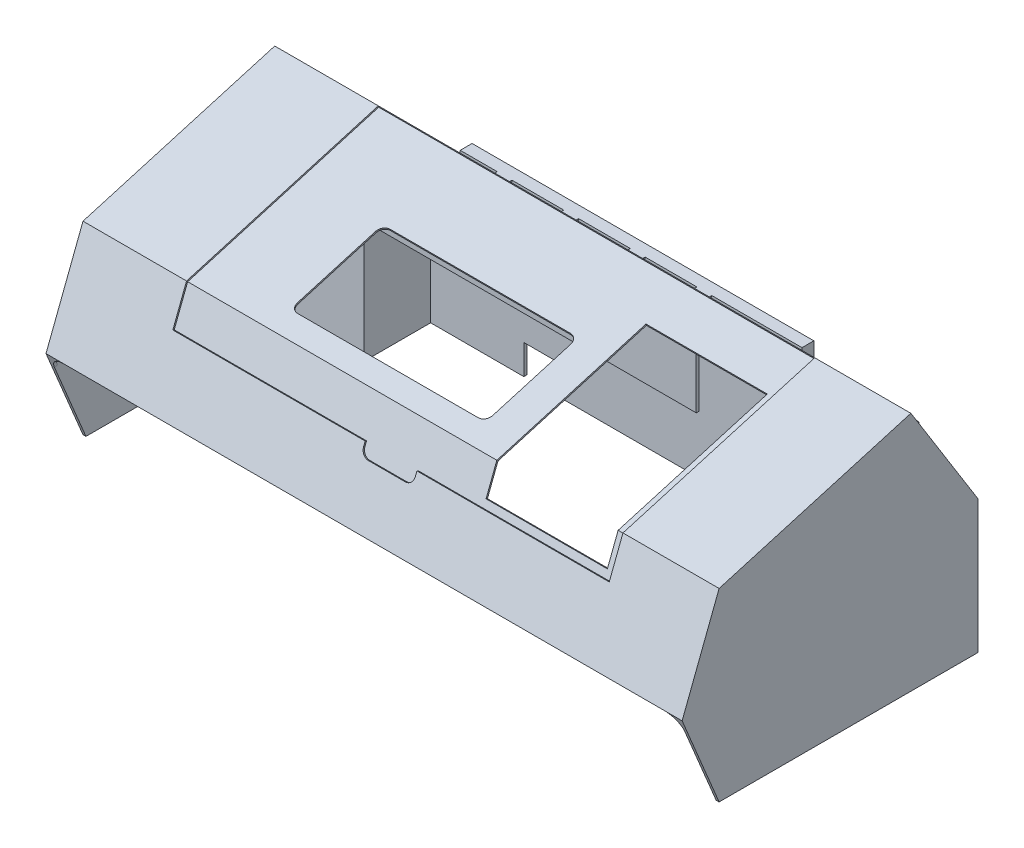
from build123d import *

# Parameters (mm, degrees)
SALIENTE_EXTRUIR1_DEPTH  = 330
CORTAR_EXTRUIR1_DEPTH    = 330
SALIENTE_EXTRUIR2_DEPTH  = 50
SALIENTE_EXTRUIR3_DEPTH  = 50
CORTAR_EXTRUIR2_DEPTH    = 48
CORTAR_EXTRUIR3_DEPTH    = 48
SALIENTE_EXTRUIR4_DEPTH  = 2
SALIENTE_EXTRUIR5_DEPTH  = 2
CORTAR_EXTRUIR4_DEPTH    = 2
CROQUIS12_W              = 295
CROQUIS12_H              = 135
CORTAR_EXTRUIR5_DEPTH    = 1
CROQUIS13_W              = 295
CROQUIS13_H              = 25.795813827
CORTAR_EXTRUIR7_DEPTH    = 1
CORTAR_EXTRUIR8_DEPTH    = 1
CROQUIS15_W              = 82
CROQUIS15_H              = 105
CORTAR_EXTRUIR9_DEPTH    = 1
CROQUIS16_W              = 82
CROQUIS16_H              = 20.300146856
CORTAR_EXTRUIR10_DEPTH   = 1
CORTAR_EXTRUIR11_REACH   = 465.661
CROQUIS17_W              = 25
CROQUIS17_H              = 20
CORTAR_EXTRUIR12_DEPTH   = 1
CROQUIS19_W              = 14
CROQUIS19_H              = 14
CORTAR_EXTRUIR13_DEPTH   = 1
CORTAR_EXTRUIR14_DEPTH   = 5
SALIENTE_EXTRUIR6_DEPTH  = 8
CROQUIS22_W              = 10
CROQUIS22_H              = 6
SALIENTE_EXTRUIR7_DEPTH  = 1
RESPIRADERO1_START       = 335
RESPIRADERO1_DEPTH       = 19.5
RESPIRADERO1_START_2     = 355.5
RESPIRADERO1_2_DEPTH     = 9.5
RESPIRADERO1_START_3     = 354.5
RESPIRADERO1_3_OUTLINE_W = 60
RESPIRADERO1_3_OUTLINE_H = 1
RESPIRADERO1_3_DEPTH     = 1
CROQUIS26_W              = 2
CROQUIS26_H              = 70
SALIENTE_EXTRUIR8_DEPTH  = 220
CROQUIS27_R              = 0.25
EJE_TAPA1_DEPTH          = 0.5
EJE_START                = -0.5
CROQUIS28_R              = 0.25
EJE_TAPA2_DEPTH          = 0.5


# Read off the part's stored shape, not the designer's step: Respiradero1
with BuildPart() as part:
    # Croquis1 → Saliente-Extruir1 (new body)
    with BuildSketch(Plane(origin=(0, 0, 0), x_dir=(0, 0, -1), z_dir=(1, 0, 0))):
        Polygon((0, 0), (-185, 0), (-210, 60), (-185, 125), (-55.380286871, 162.732346446), (0, 105), align=None)
    extrude(amount=SALIENTE_EXTRUIR1_DEPTH)

    # Croquis4 → Cortar-Extruir1 (cut)
    with BuildSketch(Plane(origin=(330, 0, 0), x_dir=(0, 0, -1), z_dir=(1, 0, 0))):
        Polygon((-182.833333333, 0), (-2, 0), (-2, 104.195827439), (-55.984752574, 160.473369765), (-183.489176933, 123.356784663), (-207.845728938, 60.029749451), align=None)
    extrude(amount=-CORTAR_EXTRUIR1_DEPTH, mode=Mode.SUBTRACT)

    # Croquis2 → Saliente-Extruir2 (add)
    with BuildSketch(Plane(origin=(330, 0, 0), x_dir=(0, 0, -1), z_dir=(1, 0, 0))):
        Polygon((-185, 0), (-210, 60), (-185, 125), (-55.380286871, 162.732346446), (-10, 90), (-10, 0), align=None)
    extrude(amount=SALIENTE_EXTRUIR2_DEPTH)

    # Croquis3 → Saliente-Extruir3 (add)
    with BuildSketch(Plane.ZY):
        Polygon((210, 60), (185, 0), (45, 0), (45, 135), (55.380286871, 162.732346446), (185, 125), align=None)
    extrude(amount=SALIENTE_EXTRUIR3_DEPTH)

    # Croquis6 → Cortar-Extruir2 (cut)
    with BuildSketch(Plane.ZY.offset(-330)):
        Polygon((56.589218277, 158.214393084), (58.202583542, 159.827758349), (183.489176933, 123.356784663), (207.845728938, 60.029749451), (182.833333333, 0), (12, 0), (12, 2), (12, 89.427236363), (51.810498539, 153.232716046), align=None)
    extrude(amount=-CORTAR_EXTRUIR2_DEPTH, mode=Mode.SUBTRACT)

    # Croquis8 → Cortar-Extruir3 (cut)
    with BuildSketch(Plane(origin=(0, 0, 0), x_dir=(0, 0, -1), z_dir=(1, 0, 0))):
        Polygon((-47, 2), (-47, 0), (-182.833333333, 0), (-207.845728938, 60.029749451), (-183.489176933, 123.356784663), (-58.203498077, 159.827492128), (-58.174989599, 159.835790957), (-58.151201716, 159.842715618), (-57.428061235, 159.088862593), (-55.335527594, 156.907456827), (-47, 134.637962552), align=None)
    extrude(amount=-CORTAR_EXTRUIR3_DEPTH, mode=Mode.SUBTRACT)

    # Croquis9 → Saliente-Extruir4 (add)
    with BuildSketch(Plane.ZY.offset(-330)):
        Polygon((12, 0), (0, 0), (0, 105), (55.380286871, 162.732346446), (58.202583542, 159.827758349), (51.810498539, 153.232716046), (12, 89.427236363), align=None)
    extrude(amount=SALIENTE_EXTRUIR4_DEPTH)

    # Croquis10 → Saliente-Extruir5 (add)
    with BuildSketch(Plane(origin=(0, 0, 0), x_dir=(0, 0, -1), z_dir=(1, 0, 0))):
        Polygon((-47, 0), (-47, 134.637962552), (-55.335527594, 156.907456827), (-58.151201716, 159.842715618), (-55.380286871, 162.732346446), (0, 105), (0, 0), align=None)
    extrude(amount=SALIENTE_EXTRUIR5_DEPTH)

    # Croquis11 → Cortar-Extruir4 (cut)
    with BuildSketch(Plane(origin=(0, -65.680473373, 157.633136095), x_dir=(1, 0, 0), z_dir=(0, -0.3846153846153845, 0.9230769230769232))):
        with BuildLine():
            Line((-48, 71.153846154), (-48, 126.153846154))
            ThreePointArc((-48, 126.153846154), (-45.071067812, 133.224913966), (-38, 136.153846154))
            Line((-38, 136.153846154), (368, 136.153846154))
            ThreePointArc((368, 136.153846154), (375.071067812, 133.224913966), (378, 126.153846154))
            Line((378, 126.153846154), (378, 71.153846154))
            Line((378, 71.153846154), (378, 69.153846154))
            Line((378, 69.153846154), (377.663887498, 69.153846154))
            Line((377.663887498, 69.153846154), (-48, 69.153846154))
            Line((-48, 69.153846154), (-48, 71.153846154))
        make_face()
    extrude(amount=-CORTAR_EXTRUIR4_DEPTH, mode=Mode.SUBTRACT)

    # Croquis12 → Cortar-Extruir5 (cut)
    with BuildSketch(Plane(origin=(0, 164.881596682, 47.997093793), x_dir=(1, 0, 0), z_dir=(0, 0.9601460231796526, 0.27949886255993606))):
        with Locations((167.5, -75.189656468)):
            Rectangle(CROQUIS12_W, CROQUIS12_H)
    extrude(amount=-CORTAR_EXTRUIR5_DEPTH, mode=Mode.SUBTRACT)

    # Croquis13 → Cortar-Extruir7 (cut)
    with BuildSketch(Plane(origin=(0, 78.092783505, 203.041237113), x_dir=(1, 0, 0), z_dir=(0, 0.3589790793088692, 0.9333456062030595))):
        with Locations((167.5, 37.359164189)):
            Rectangle(CROQUIS13_W, CROQUIS13_H)
    extrude(amount=-CORTAR_EXTRUIR7_DEPTH, mode=Mode.SUBTRACT)

    # Croquis14 → Cortar-Extruir8 (cut)
    with BuildSketch(Plane(origin=(0, 78.092783505, 203.041237113), x_dir=(1, 0, 0), z_dir=(0, 0.3589790793088692, 0.9333456062030595))):
        with BuildLine():
            Line((150, 24.461257276), (150, 21.461257276))
            ThreePointArc((150, 21.461257276), (151.464466094, 17.92572337), (155, 16.461257276))
            Line((155, 16.461257276), (180, 16.461257276))
            ThreePointArc((180, 16.461257276), (183.535533906, 17.92572337), (185, 21.461257276))
            Line((185, 21.461257276), (185, 24.461257276))
            Line((185, 24.461257276), (150, 24.461257276))
        make_face()
    extrude(amount=-CORTAR_EXTRUIR8_DEPTH, mode=Mode.SUBTRACT)

    # Croquis15 → Cortar-Extruir9 (cut)
    with BuildSketch(Plane(origin=(0, 163.921450659, 47.717594931), x_dir=(1, 0, 0), z_dir=(0, 0.9601460231796526, 0.2794988625599361))):
        with BuildLine():
            Line((80, -62.193989497), (202, -62.193989497))
            ThreePointArc((202, -62.193989497), (205.535533906, -63.658455592), (207, -67.193989497))
            Line((207, -67.193989497), (207, -122.193989497))
            ThreePointArc((207, -122.193989497), (205.535533906, -125.729523403), (202, -127.193989497))
            Line((202, -127.193989497), (80, -127.193989497))
            ThreePointArc((80, -127.193989497), (76.464466094, -125.729523403), (75, -122.193989497))
            Line((75, -122.193989497), (75, -67.193989497))
            ThreePointArc((75, -67.193989497), (76.464466094, -63.658455592), (80, -62.193989497))
        make_face()
        with Locations((270, -89.693989497)):
            Rectangle(CROQUIS15_W, CROQUIS15_H)
    extrude(amount=-CORTAR_EXTRUIR9_DEPTH, mode=Mode.SUBTRACT)

    # Croquis16 → Cortar-Extruir10 (cut)
    with BuildSketch(Plane(origin=(0, 77.733804426, 202.107891507), x_dir=(1, 0, 0), z_dir=(0, 0.35897907930886963, 0.9333456062030593))):
        with Locations((270, 39.611330704)):
            Rectangle(CROQUIS16_W, CROQUIS16_H)
    extrude(amount=-CORTAR_EXTRUIR10_DEPTH, mode=Mode.SUBTRACT)

    # Croquis17 → Cortar-Extruir11 (cut, up to next)
    with BuildSketch(Plane(origin=(0, 0, 0), x_dir=(-1, 0, 0), z_dir=(0, 0, -1)), mode=Mode.PRIVATE) as cortar_extruir11_sk1:
        with Locations((-77.5, 10)):
            Rectangle(CROQUIS17_W, CROQUIS17_H)
    cortar_extruir11_tool1 = extrude(cortar_extruir11_sk1.sketch, amount=-CORTAR_EXTRUIR11_REACH, mode=Mode.PRIVATE) & part.part
    add(cortar_extruir11_tool1.solids().sort_by_distance((77.5, 10, 0))[0], mode=Mode.SUBTRACT)

    # Croquis18 → Cortar-Extruir12 (cut)
    with BuildSketch(Plane(origin=(0, 0, 45), x_dir=(-1, 0, 0), z_dir=(0, 0, -1))):
        with BuildLine():
            Line((9, 123), (23, 123))
            ThreePointArc((23, 123), (24.414213562, 122.414213562), (25, 121))
            Line((25, 121), (25, 107))
            ThreePointArc((25, 107), (24.414213562, 105.585786438), (23, 105))
            Line((23, 105), (9, 105))
            ThreePointArc((9, 105), (7.585786438, 105.585786438), (7, 107))
            Line((7, 107), (7, 121))
            ThreePointArc((7, 121), (7.585786438, 122.414213562), (9, 123))
        make_face()
    extrude(amount=-CORTAR_EXTRUIR12_DEPTH, mode=Mode.SUBTRACT)

    # Croquis19 → Cortar-Extruir13 (cut)
    with BuildSketch(Plane(origin=(0, 0, 46), x_dir=(-1, 0, 0), z_dir=(0, 0, -1))):
        with Locations((16, 114)):
            Rectangle(CROQUIS19_W, CROQUIS19_H)
    extrude(amount=-CORTAR_EXTRUIR13_DEPTH, mode=Mode.SUBTRACT)

    # Croquis20 → Cortar-Extruir14 (cut)
    with BuildSketch(Plane(origin=(0, 50.317577853, -52.454618801), x_dir=(-1, 0, 0), z_dir=(0, 0.692253585884336, -0.7216543305698916))):
        with BuildLine():
            Line((-10, 77.77370471), (-10, 143.77370471))
            Line((-10, 143.77370471), (-10, 145.77370471))
            Line((-10, 145.77370471), (-12, 145.77370471))
            Line((-12, 145.77370471), (-228, 145.77370471))
            Line((-228, 145.77370471), (-230, 145.77370471))
            Line((-230, 145.77370471), (-230, 143.77370471))
            Line((-230, 143.77370471), (-230, 117.77370471))
            ThreePointArc((-230, 117.77370471), (-230.585786438, 116.359491147), (-232, 115.77370471))
            Line((-232, 115.77370471), (-243, 115.77370471))
            ThreePointArc((-243, 115.77370471), (-244.414213562, 116.359491147), (-245, 117.77370471))
            Line((-245, 117.77370471), (-245, 125.77370471))
            ThreePointArc((-245, 125.77370471), (-245.585786438, 127.187918272), (-247, 127.77370471))
            Line((-247, 127.77370471), (-268, 127.77370471))
            ThreePointArc((-268, 127.77370471), (-269.414213562, 127.187918272), (-270, 125.77370471))
            Line((-270, 125.77370471), (-270, 107.77370471))
            ThreePointArc((-270, 107.77370471), (-270.585786438, 106.359491147), (-272, 105.77370471))
            Line((-272, 105.77370471), (-295.359934232, 105.77370471))
            ThreePointArc((-295.359934232, 105.77370471), (-296.774147795, 105.187918272), (-297.359934232, 103.77370471))
            Line((-297.359934232, 103.77370471), (-297.359934232, 77.77370471))
            ThreePointArc((-297.359934232, 77.77370471), (-296.774147795, 76.359491147), (-295.359934232, 75.77370471))
            Line((-295.359934232, 75.77370471), (-12, 75.77370471))
            ThreePointArc((-12, 75.77370471), (-10.585786438, 76.359491147), (-10, 77.77370471))
        make_face()
    extrude(amount=-CORTAR_EXTRUIR14_DEPTH, mode=Mode.SUBTRACT)

    # Croquis21 → Saliente-Extruir6 (add)
    with BuildSketch(Plane(origin=(0, 0, 0), x_dir=(-1, 0, 0), z_dir=(0, 0, -1))):
        Polygon((-28, 105), (-28, 117), (-259.035302497, 117), (-259.035302497, 100), (-28, 100), align=None)
    extrude(amount=-SALIENTE_EXTRUIR6_DEPTH)

    # Croquis22 → Saliente-Extruir7 (add)
    with BuildSketch(Plane(origin=(0, 117, 0), x_dir=(1, 0, 0), z_dir=(0, 1, 0))):
        with Locations((58, -11)):
            Rectangle(CROQUIS22_W, CROQUIS22_H)
        with Locations((103, -11)):
            Rectangle(CROQUIS22_W, CROQUIS22_H)
        with Locations((148, -11)):
            Rectangle(CROQUIS22_W, CROQUIS22_H)
        with Locations((193, -11)):
            Rectangle(CROQUIS22_W, CROQUIS22_H)
    extrude(amount=-SALIENTE_EXTRUIR7_DEPTH)

    # Respiradero1 outline → Respiradero1 (cut)
    with BuildSketch(Plane.YZ.offset(RESPIRADERO1_START)):
        Polygon((28.5, 11), (28.5, 10), (30.5, 10), (30.5, 11), (31.5, 11), (31.5, 10), (33.5, 10), (33.5, 11), (34.5, 11), (34.5, 10), (36.5, 10), (36.5, 11), (37.5, 11), (37.5, 10), (39.5, 10), (39.5, 11), (40.5, 11), (40.5, 10), (42.5, 10), (42.5, 11), (43.5, 11), (43.5, 10), (45.5, 10), (45.5, 11), (46.5, 11), (46.5, 10), (48.5, 10), (48.5, 11), (49.5, 11), (49.5, 10), (51.5, 10), (51.5, 11), (52.5, 11), (52.5, 10), (54.5, 10), (54.5, 11), (55.5, 11), (55.5, 10), (57.5, 10), (57.5, 11), (58.5, 11), (58.5, 10), (60.5, 10), (60.5, 11), (61.5, 11), (61.5, 10), (63.5, 10), (63.5, 11), (64.5, 11), (64.5, 10), (66.5, 10), (66.5, 11), (67.5, 11), (67.5, 10), (69.5, 10), (69.5, 11), (70.5, 11), (70.5, 10), (72.5, 10), (72.5, 11), (73.5, 11), (73.5, 10), (75.5, 10), (75.5, 11), (76.5, 11), (76.5, 10), (78.5, 10), (78.5, 11), (79.5, 11), (79.5, 10), (81.5, 10), (81.5, 11), (82.5, 11), (82.5, 10), (85, 10), (85, 12), (25, 12), (25, 10), (27.5, 10), (27.5, 11), align=None)
    extrude(amount=RESPIRADERO1_DEPTH, mode=Mode.SUBTRACT)

    # Respiradero1 2 outline → Respiradero1 2 (cut)
    with BuildSketch(Plane.YZ.offset(RESPIRADERO1_START_2)):
        Polygon((28.5, 11), (28.5, 10), (30.5, 10), (30.5, 11), (31.5, 11), (31.5, 10), (33.5, 10), (33.5, 11), (34.5, 11), (34.5, 10), (36.5, 10), (36.5, 11), (37.5, 11), (37.5, 10), (39.5, 10), (39.5, 11), (40.5, 11), (40.5, 10), (42.5, 10), (42.5, 11), (43.5, 11), (43.5, 10), (45.5, 10), (45.5, 11), (46.5, 11), (46.5, 10), (48.5, 10), (48.5, 11), (49.5, 11), (49.5, 10), (51.5, 10), (51.5, 11), (52.5, 11), (52.5, 10), (54.5, 10), (54.5, 11), (55.5, 11), (55.5, 10), (57.5, 10), (57.5, 11), (58.5, 11), (58.5, 10), (60.5, 10), (60.5, 11), (61.5, 11), (61.5, 10), (63.5, 10), (63.5, 11), (64.5, 11), (64.5, 10), (66.5, 10), (66.5, 11), (67.5, 11), (67.5, 10), (69.5, 10), (69.5, 11), (70.5, 11), (70.5, 10), (72.5, 10), (72.5, 11), (73.5, 11), (73.5, 10), (75.5, 10), (75.5, 11), (76.5, 11), (76.5, 10), (78.5, 10), (78.5, 11), (79.5, 11), (79.5, 10), (81.5, 10), (81.5, 11), (82.5, 11), (82.5, 10), (85, 10), (85, 12), (25, 12), (25, 10), (27.5, 10), (27.5, 11), align=None)
    extrude(amount=RESPIRADERO1_2_DEPTH, mode=Mode.SUBTRACT)

    # Respiradero1 3 outline → Respiradero1 3 (cut)
    with BuildSketch(Plane.YZ.offset(RESPIRADERO1_START_3)):
        with Locations((55, 11.5)):
            Rectangle(RESPIRADERO1_3_OUTLINE_W, RESPIRADERO1_3_OUTLINE_H)
    extrude(amount=RESPIRADERO1_3_DEPTH, mode=Mode.SUBTRACT)

    # Croquis26 → Saliente-Extruir8 (add)
    with BuildSketch(Plane(origin=(10, 0, 0), x_dir=(0, 0, -1), z_dir=(1, 0, 0))):
        with Locations((-49.457751012, 120.51580314)):
            Rectangle(CROQUIS26_W, CROQUIS26_H)
    extrude(amount=SALIENTE_EXTRUIR8_DEPTH)

    # Croquis27 → eje tapa1 (cut)
    with BuildSketch(Plane(origin=(20, 0, 0), x_dir=(0, 0, -1), z_dir=(1, 0, 0))):
        with Locations((-55.720610451, 162.112524003)):
            Circle(CROQUIS27_R)
    extrude(amount=-EJE_TAPA1_DEPTH, mode=Mode.SUBTRACT)

    # Croquis28 → eje tapa2 (cut)
    with BuildSketch(Plane.ZY.offset(-315).offset(EJE_START)):
        with Locations(Location((55.720610451, 162.112524003, 0), (0, 0, 180))):
            Circle(CROQUIS28_R)
    extrude(amount=EJE_TAPA2_DEPTH, mode=Mode.SUBTRACT)


solid = part.part
